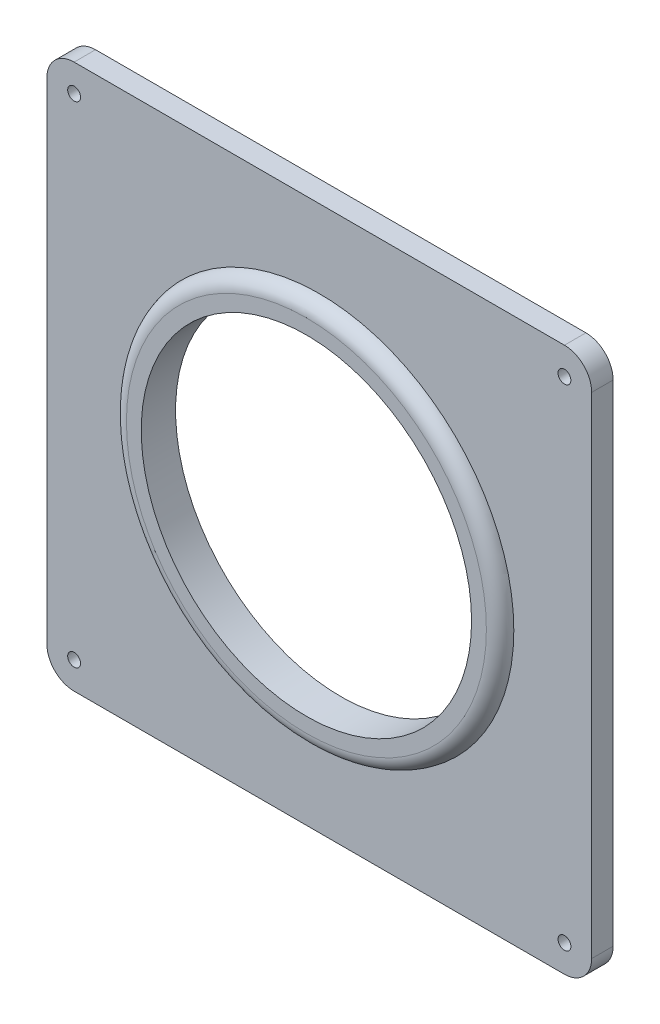
from build123d import *

# Parameters (mm, degrees)
SKETCH1_W           = 127
SKETCH1_H           = 127
SKETCH1_W_2         = 121
SKETCH1_H_2         = 121
SKETCH1_R           = 38.5
BOSS_EXTRUDE1_DEPTH = 5
SKETCH3_R           = 45.35
SKETCH3_R_2         = 38.5
BOSS_EXTRUDE2_DEPTH = 3
FILLET1_R           = 6.35
FILLET2_R           = 3.425
SKETCH5_R           = 1.5
CUT_EXTRUDE2_DEPTH  = 90.94164775


with BuildPart() as part:
    # Sketch1 → Boss-Extrude1 (new body)
    # profile 1 of 2: a face of its own
    with BuildSketch(Plane.XY):
        Rectangle(SKETCH1_W, SKETCH1_H)
        Rectangle(SKETCH1_W_2, SKETCH1_H_2, mode=Mode.SUBTRACT)
    # profile 2 of 2: a face of its own
    with BuildSketch(Plane.XY):
        Rectangle(SKETCH1_W_2, SKETCH1_H_2)
        Circle(SKETCH1_R, mode=Mode.SUBTRACT)
    extrude(amount=BOSS_EXTRUDE1_DEPTH)

    # Sketch3 → Boss-Extrude2 (add)
    with BuildSketch(Plane.XY.offset(5)):
        Circle(SKETCH3_R)
        Circle(SKETCH3_R_2, mode=Mode.SUBTRACT)
    extrude(amount=BOSS_EXTRUDE2_DEPTH)

    # Fillet1
    fillet1_edges = [part.edges().sort_by_distance(p)[0] for p in [
        (-63.5, 63.5, 2.5),
        (63.5, 63.5, 2.5),
        (63.5, -63.5, 2.5),
        (-63.5, -63.5, 2.5),
    ]]
    fillet(fillet1_edges, radius=FILLET1_R)

    # Fillet2
    # the kernel refuses this fillet: 3.425 mm, written as the material it takes off along each edge
    with BuildSketch(Plane(origin=(0, 0, 8), x_dir=(1, 0, 0), z_dir=(0, -1, 0))) as fillet2_piece_1:
        with BuildLine():
            CenterArc((41.951470906, -3.425), FILLET2_R, 7.12806839, 82.87193161)
            Line((41.951470906, 0), (41.951470906, 0.0685))
            Line((41.951470906, 0.0685), (45.35, 0.0685))
            Line((45.35, 0.0685), (45.4185, 0))
            ThreePointArc((45.4185, 0), (45.4185, -1.5), (45.417970582, -2.9915))
            Line((45.417970582, -2.9915), (45.35, -3))
        make_face()
    revolve(axis=Axis((0, 0, 8), (0, 0, 1)), mode=Mode.SUBTRACT)

    # Sketch5 → Cut-Extrude2 (cut, through all)
    with BuildSketch(Plane.XY.offset(5)):
        with Locations((-57.15, 57.15)):
            Circle(SKETCH5_R)
        with Locations((-57.15, -57.15)):
            Circle(SKETCH5_R)
        with Locations((57.15, -57.15)):
            Circle(SKETCH5_R)
        with Locations((57.15, 57.15)):
            Circle(SKETCH5_R)
    extrude(amount=-CUT_EXTRUDE2_DEPTH, mode=Mode.SUBTRACT)


solid = part.part
